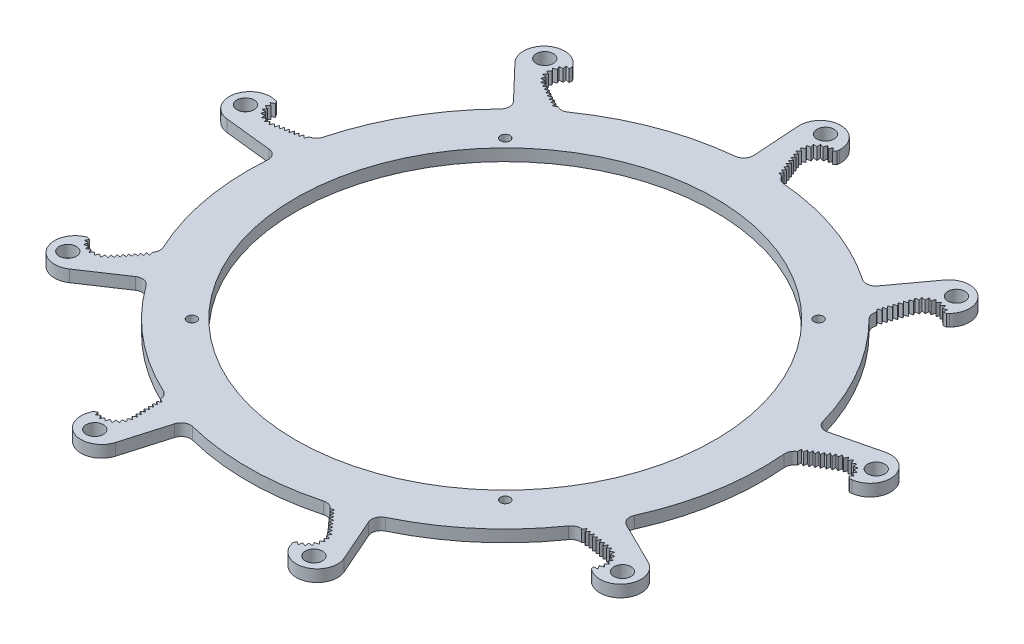
from build123d import *

# Parameters (mm, degrees)
SKETCH1_R           = 68.58
SKETCH1_R_2         = 55.88
BOSS_EXTRUDE1_DEPTH = 3.175
BOSS_EXTRUDE2_START = -3.175
BOSS_EXTRUDE2_DEPTH = 3.175
CIRPATTERN1_COUNT   = 9
SKETCH4_R           = 1.27
CUT_EXTRUDE1_DEPTH  = 126.612114435
CIRPATTERN14_COUNT  = 4
CUT_EXTRUDE2_DEPTH  = 126.612114435
CRVPATTERN1_DEPTH   = 3.175
CIRPATTERN15_COUNT  = 9
SKETCH3_R           = 2.286
CUT_EXTRUDE3_DEPTH  = 126.612114435
CIRPATTERN16_COUNT  = 9


# Read off the part's stored shape, not the designer's step: CrvPattern1
with BuildPart() as part:
    # Sketch1 → Boss-Extrude1 (new body)
    with BuildSketch(Plane(origin=(0, 0, 0), x_dir=(1, 0, 0), z_dir=(0, 1, 0))):
        with Locations(Location((0, 0, 0), (0, 0, 270))):
            Circle(SKETCH1_R)
        with Locations(Location((0, 0, 0), (0, 0, 270))):
            Circle(SKETCH1_R_2, mode=Mode.SUBTRACT)
    extrude(amount=BOSS_EXTRUDE1_DEPTH)

    # Sketch2 → Boss-Extrude2 (add)
    with BuildSketch(Plane(origin=(0, 3.175, 0), x_dir=(1, 0, 0), z_dir=(0, 1, 0)).offset(BOSS_EXTRUDE2_START)):
        with BuildLine():
            Line((-4.648503105, 70.922452149), (-5.395010683, 82.311956847))
            Line((-5.395010683, 82.311956847), (-5.478072657, 83.579237679))
            ThreePointArc((-5.478072657, 83.579237679), (0, 89.428116328), (5.478072657, 83.579237679))
            Line((5.478072657, 83.579237679), (5.395010683, 82.311956847))
            ThreePointArc((5.395010683, 82.311956847), (1.617293808, 81.120206155), (0.93984527, 77.217325427))
            Line((0.93984527, 77.217325427), (3.81, 69.921657137))
            ThreePointArc((3.81, 69.921657137), (4.653834894, 68.816417694), (5.953179428, 68.321124513))
            ThreePointArc((5.953179428, 68.321124513), (-0.488833742, 68.57825779), (-6.926526743, 68.22931648))
            ThreePointArc((-6.926526743, 68.22931648), (-5.243785443, 69.115963701), (-4.648503105, 70.922452149))
        make_face()
    boss_extrude2 = extrude(amount=BOSS_EXTRUDE2_DEPTH)

    # CirPattern1: Boss-Extrude2 ×9 about axis
    cirpattern1_axis = Axis((0, 0, 0), (0, 1, 0))
    for i in range(1, CIRPATTERN1_COUNT):
        add(boss_extrude2.rotate(cirpattern1_axis, i * 360 / CIRPATTERN1_COUNT))

    # Sketch4 → Cut-Extrude1 (cut, through all)
    with BuildSketch(Plane(origin=(0, 3.175, 0), x_dir=(1, 0, 0), z_dir=(0, 1, 0))):
        with Locations(Location((41.758190963, 41.758190963, 0), (0, 0, 270))):
            Circle(SKETCH4_R)
    cut_extrude1 = extrude(amount=-CUT_EXTRUDE1_DEPTH, mode=Mode.SUBTRACT)

    # CirPattern14: Cut-Extrude1 ×4 about axis
    cirpattern14_axis = Axis((0, 0, 0), (0, 1, 0))
    for i in range(1, CIRPATTERN14_COUNT):
        add(cut_extrude1.rotate(cirpattern14_axis, i * 360 / CIRPATTERN14_COUNT), mode=Mode.SUBTRACT)

    # Sketch6 → Cut-Extrude2 (cut, through all)
    with BuildSketch(Plane(origin=(0, 3.175, 0), x_dir=(1, 0, 0), z_dir=(0, 1, 0))):
        Polygon((3.492302411, 71.076120273), (3.957242109, 69.894286496), (2.779305238, 70.113251627), align=None)
    cut_extrude2 = extrude(amount=-CUT_EXTRUDE2_DEPTH, mode=Mode.SUBTRACT)

    # CrvPattern1 outline → CrvPattern1 (cut)
    with BuildSketch(Plane(origin=(0, 0, 0), x_dir=(1, 0, 0), z_dir=(0, 1, 0))):
        with BuildLine():
            Line((0.940711797, 77.166791582), (0.329256214, 76.341050005))
            Line((0.329256214, 76.341050005), (1.359950976, 76.149455515))
            Line((1.359950976, 76.149455515), (0.93984527, 77.217325427))
            ThreePointArc((0.93984527, 77.217325427), (1.617293808, 81.120206155), (5.395010683, 82.311956847))
            Line((5.395010683, 82.311956847), (5.44100327, 83.013668123))
            Line((5.44100327, 83.013668123), (4.84878437, 82.438133766))
            Line((4.84878437, 82.438133766), (4.242655964, 83.304873176))
            Line((4.242655964, 83.304873176), (3.729171189, 82.380231497))
            Line((3.729171189, 82.380231497), (2.898698206, 83.03516926))
            Line((2.898698206, 83.03516926), (2.673905231, 82.001681492))
            Line((2.673905231, 82.001681492), (1.689757293, 82.389085266))
            Line((1.689757293, 82.389085266), (1.772785019, 81.334696701))
            Line((1.772785019, 81.334696701), (0.718708814, 81.421600119))
            Line((0.718708814, 81.421600119), (1.102491944, 80.436034617))
            Line((1.102491944, 80.436034617), (0.068184752, 80.215042577))
            Line((0.068184752, 80.215042577), (0.720065018, 79.382167456))
            Line((0.720065018, 79.382167456), (-0.206458139, 78.872085414))
            Line((-0.206458139, 78.872085414), (0.658047102, 78.262774707))
            Line((0.658047102, 78.262774707), (-0.081848948, 77.507008417))
            Line((-0.081848948, 77.507008417), (0.940711797, 77.166791582))
        make_face()
        Polygon((3.401658496, 70.959623533), (2.994836261, 71.993728089), (2.370963734, 71.151218023), align=None)
        Polygon((2.993316992, 71.99758993), (2.586494757, 73.031694485), (1.96262223, 72.189184419), align=None)
        Polygon((2.584975488, 73.035556326), (2.178153253, 74.069660882), (1.554280726, 73.227150816), align=None)
        Polygon((2.176633984, 74.073522723), (1.769811749, 75.107627278), (1.145939222, 74.265117212), align=None)
        Polygon((1.76829248, 75.111489119), (1.361470245, 76.145593674), (0.737597718, 75.303083609), align=None)
    crvpattern1 = extrude(amount=CRVPATTERN1_DEPTH, mode=Mode.SUBTRACT)

    # CirPattern15: Cut-Extrude2, CrvPattern1 ×9 about axis
    cirpattern15_axis = Axis((0, 0, 0), (0, 1, 0))
    add([cut_extrude2.rotate(cirpattern15_axis, i * 360 / CIRPATTERN15_COUNT) for i in range(1, CIRPATTERN15_COUNT)], mode=Mode.SUBTRACT)
    add([crvpattern1.rotate(cirpattern15_axis, i * 360 / CIRPATTERN15_COUNT) for i in range(1, CIRPATTERN15_COUNT)], mode=Mode.SUBTRACT)

    # Sketch3 → Cut-Extrude3 (cut, through all)
    with BuildSketch(Plane(origin=(0, 3.175, 0), x_dir=(1, 0, 0), z_dir=(0, 1, 0))):
        with Locations(Location((0, 85.364116328, 0), (0, 0, 270))):
            Circle(SKETCH3_R)
    cut_extrude3 = extrude(amount=-CUT_EXTRUDE3_DEPTH, mode=Mode.SUBTRACT)

    # CirPattern16: Cut-Extrude3 ×9 about axis
    cirpattern16_axis = Axis((0, 0, 0), (0, 1, 0))
    for i in range(1, CIRPATTERN16_COUNT):
        add(cut_extrude3.rotate(cirpattern16_axis, i * 360 / CIRPATTERN16_COUNT), mode=Mode.SUBTRACT)


solid = part.part
